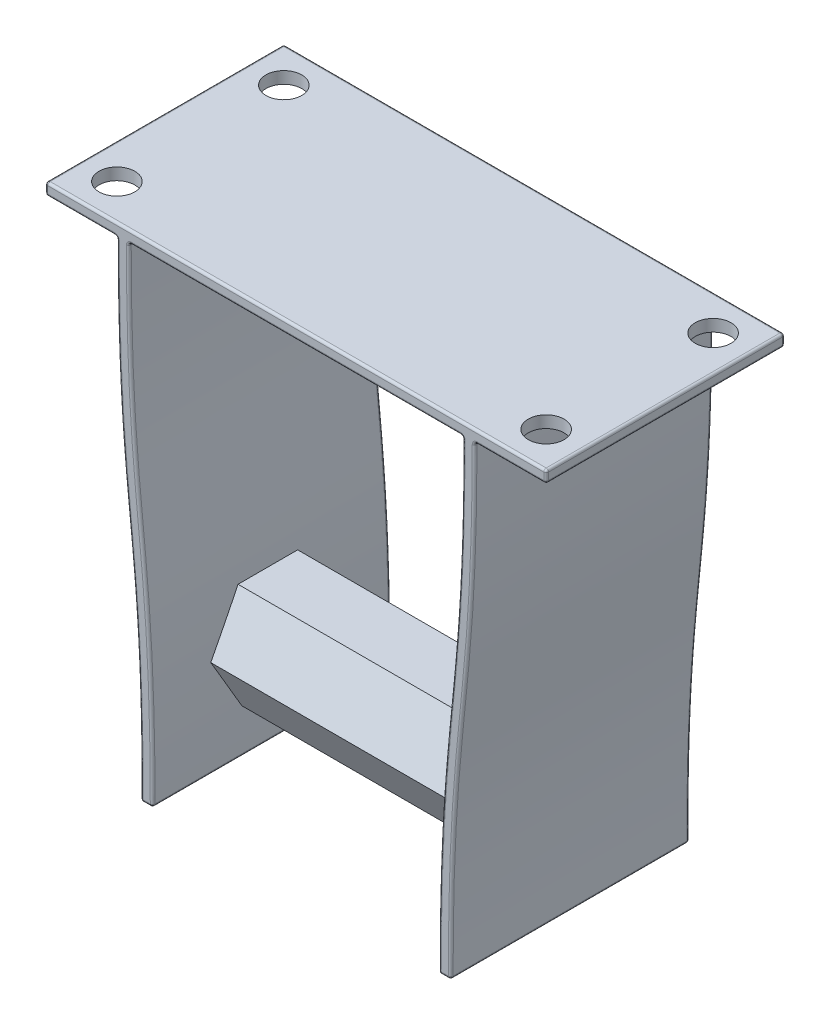
from build123d import *

# Parameters (mm, degrees)
BOSS_EXTRUDE3_DEPTH             = 25.4
SKETCH5_W                       = 38.1
SKETCH5_H                       = 25.4
BOSS_EXTRUDE4_DEPTH             = 1.27
BOSS_EXTRUDE5_REACH             = 43.465
BOSS_EXTRUDE5_DIRECTION_2_REACH = 43.465
SKETCH7_W                       = 25.4
SKETCH7_H                       = 1.27
BOSS_EXTRUDE6_DEPTH             = 7.62
SKETCH8_W                       = 25.4
SKETCH8_H                       = 1.27
BOSS_EXTRUDE7_DEPTH             = 7.62
CUT_EXTRUDE1_REACH              = 74.22
SKETCH9_R                       = 1.905
FILLET2_R                       = 0.254


# Read off the part's stored shape, not the designer's step: Boss-Extrude3
with BuildPart() as part:
    # Boss-Extrude3 outline → Boss-Extrude3 (new body)
    with BuildSketch(Plane.XY):
        with BuildLine():
            Line((2.60047619, 25.4), (1.33047619, 25.4))
            add(Edge.make_bspline(
                [(1.33047619, 25.4), (1.33047619, 0), (-1.20952381, 0), (-1.20952381, -25.4)],
                knots=[0, 0, 0, 0, 1, 1, 1, 1], degree=3))
            Line((-1.20952381, -25.4), (0.06047619, -25.4))
            add(Edge.make_bspline(
                [(0.06047619, -25.4), (0, 0), (2.60047619, 0), (2.60047619, 25.4)],
                knots=[0, 0, 0, 0, 1, 1, 1, 1], degree=3))
        make_face()
    boss_extrude3 = extrude(amount=BOSS_EXTRUDE3_DEPTH)

    # Sketch5 → Boss-Extrude4 (add)
    with BuildSketch(Plane(origin=(0, 25.4, 0), x_dir=(1, 0, 0), z_dir=(0, 1, 0))):
        with Locations((-16.44952381, -12.7)):
            Rectangle(SKETCH5_W, SKETCH5_H)
    extrude(amount=BOSS_EXTRUDE4_DEPTH)

    # Mirror2: Boss-Extrude3 across plane
    add(boss_extrude3.mirror(Plane.ZY.offset(16.44952381)))

    # Sketch6 → Boss-Extrude5 (add, up to next)
    with BuildSketch(Plane.ZY.offset(16.44952381), mode=Mode.PRIVATE) as boss_extrude5_sk1:
        Polygon((19.05, -15.24), (15.875, -9.740738686), (9.525, -9.740738686), (6.35, -15.24), (9.525, -20.739261314), (15.875, -20.739261314), align=None)
    boss_extrude5_tool1 = extrude(boss_extrude5_sk1.sketch, amount=-BOSS_EXTRUDE5_REACH, mode=Mode.PRIVATE) - part.part
    add(boss_extrude5_tool1.solids().sort_by_distance((-16.449524, -15.24, 12.7))[0])

    # Sketch6 → Boss-Extrude5 direction 2 (add, up to next)
    with BuildSketch(Plane.ZY.offset(16.44952381), mode=Mode.PRIVATE) as boss_extrude5_direction_2_sk1:
        Polygon((19.05, -15.24), (15.875, -9.740738686), (9.525, -9.740738686), (6.35, -15.24), (9.525, -20.739261314), (15.875, -20.739261314), align=None)
    boss_extrude5_direction_2_tool1 = extrude(boss_extrude5_direction_2_sk1.sketch, amount=BOSS_EXTRUDE5_DIRECTION_2_REACH, mode=Mode.PRIVATE) - part.part
    add(boss_extrude5_direction_2_tool1.solids().sort_by_distance((-16.449524, -15.24, 12.7))[0])

    # Sketch7 → Boss-Extrude6 (add)
    with BuildSketch(Plane.ZY.offset(35.49952381)):
        with Locations((12.7, 26.035)):
            Rectangle(SKETCH7_W, SKETCH7_H)
    extrude(amount=BOSS_EXTRUDE6_DEPTH)

    # Sketch8 → Boss-Extrude7 (add)
    with BuildSketch(Plane(origin=(2.60047619, 0, 0), x_dir=(0, 0, -1), z_dir=(1, 0, 0))):
        with Locations((-12.7, 26.035)):
            Rectangle(SKETCH8_W, SKETCH8_H)
    extrude(amount=BOSS_EXTRUDE7_DEPTH)

    # Sketch9 → Cut-Extrude1 (cut, up to next)
    with BuildSketch(Plane(origin=(0, 26.67, 0), x_dir=(1, 0, 0), z_dir=(0, 1, 0)), mode=Mode.PRIVATE) as cut_extrude1_sk1:
        with Locations(Location((-39.30952381, -3.81, 0), (0, 0, 270))):
            Circle(SKETCH9_R)
    cut_extrude1_tool1 = extrude(cut_extrude1_sk1.sketch, amount=-CUT_EXTRUDE1_REACH, mode=Mode.PRIVATE) & part.part
    # Sketch9 → Cut-Extrude1 (cut, up to next)
    with BuildSketch(Plane(origin=(0, 26.67, 0), x_dir=(1, 0, 0), z_dir=(0, 1, 0)), mode=Mode.PRIVATE) as cut_extrude1_sk2:
        with Locations(Location((-39.30952381, -21.59, 0), (0, 0, 270))):
            Circle(SKETCH9_R)
    cut_extrude1_tool2 = extrude(cut_extrude1_sk2.sketch, amount=-CUT_EXTRUDE1_REACH, mode=Mode.PRIVATE) & part.part
    # Sketch9 → Cut-Extrude1 (cut, up to next)
    with BuildSketch(Plane(origin=(0, 26.67, 0), x_dir=(1, 0, 0), z_dir=(0, 1, 0)), mode=Mode.PRIVATE) as cut_extrude1_sk3:
        with Locations(Location((6.41047619, -3.81, 0), (0, 0, 270))):
            Circle(SKETCH9_R)
    cut_extrude1_tool3 = extrude(cut_extrude1_sk3.sketch, amount=-CUT_EXTRUDE1_REACH, mode=Mode.PRIVATE) & part.part
    # Sketch9 → Cut-Extrude1 (cut, up to next)
    with BuildSketch(Plane(origin=(0, 26.67, 0), x_dir=(1, 0, 0), z_dir=(0, 1, 0)), mode=Mode.PRIVATE) as cut_extrude1_sk4:
        with Locations(Location((6.41047619, -21.59, 0), (0, 0, 270))):
            Circle(SKETCH9_R)
    cut_extrude1_tool4 = extrude(cut_extrude1_sk4.sketch, amount=-CUT_EXTRUDE1_REACH, mode=Mode.PRIVATE) & part.part
    add(cut_extrude1_tool1.solids().sort_by_distance((-39.309524, 26.67, 3.81))[0], mode=Mode.SUBTRACT)
    add(cut_extrude1_tool2.solids().sort_by_distance((-39.309524, 26.67, 21.59))[0], mode=Mode.SUBTRACT)
    add(cut_extrude1_tool3.solids().sort_by_distance((6.410476, 26.67, 3.81))[0], mode=Mode.SUBTRACT)
    add(cut_extrude1_tool4.solids().sort_by_distance((6.410476, 26.67, 21.59))[0], mode=Mode.SUBTRACT)

    # Fillet2
    fillet2_edges = [part.edges().sort_by_distance(p)[0] for p in [
        (1.307885219, 0.00086569, 25.4),
        (-16.44952381, 25.4, 0),
        (-35.49952381, 25.4, 12.7),
        (-16.44952381, 26.67, 0),
        (-16.44952381, 26.67, 25.4),
        (-16.44952381, 25.4, 25.4),
        (-32.959523617, -1.925e-06, 25.4),
        (-31.689523809, -25.4, 12.7),
        (-34.229523809, 25.4, 12.7),
        (-34.206932838, 0.00086569, 25.4),
        (-32.324523809, -25.4, 25.4),
        (-32.959523809, -25.4, 12.7),
        (-32.959523617, -1.925e-06, 0),
        (-32.324523809, -25.4, 0),
        (-34.206932838, 0.00086569, 0),
        (0.060475998, -1.925e-06, 25.4),
        (1.307885219, 0.00086569, 0),
        (-0.57452381, -25.4, 0),
        (0.060475998, -1.925e-06, 0),
        (-39.30952381, 25.4, 0),
        (-39.30952381, 25.4, 25.4),
        (-43.11952381, 26.035, 0),
        (-43.11952381, 25.4, 12.7),
        (-43.11952381, 26.035, 25.4),
        (-43.11952381, 26.67, 12.7),
        (1.33047619, 25.4, 12.7),
        (2.60047619, 25.4, 12.7),
        (0.06047619, -25.4, 12.7),
        (6.41047619, 25.4, 25.4),
        (6.41047619, 25.4, 0),
        (-1.20952381, -25.4, 12.7),
        (10.22047619, 26.035, 25.4),
        (10.22047619, 25.4, 12.7),
        (10.22047619, 26.035, 0),
        (10.22047619, 26.67, 12.7),
        (-0.57452381, -25.4, 25.4),
    ]]
    fillet(fillet2_edges, radius=FILLET2_R)


solid = part.part
